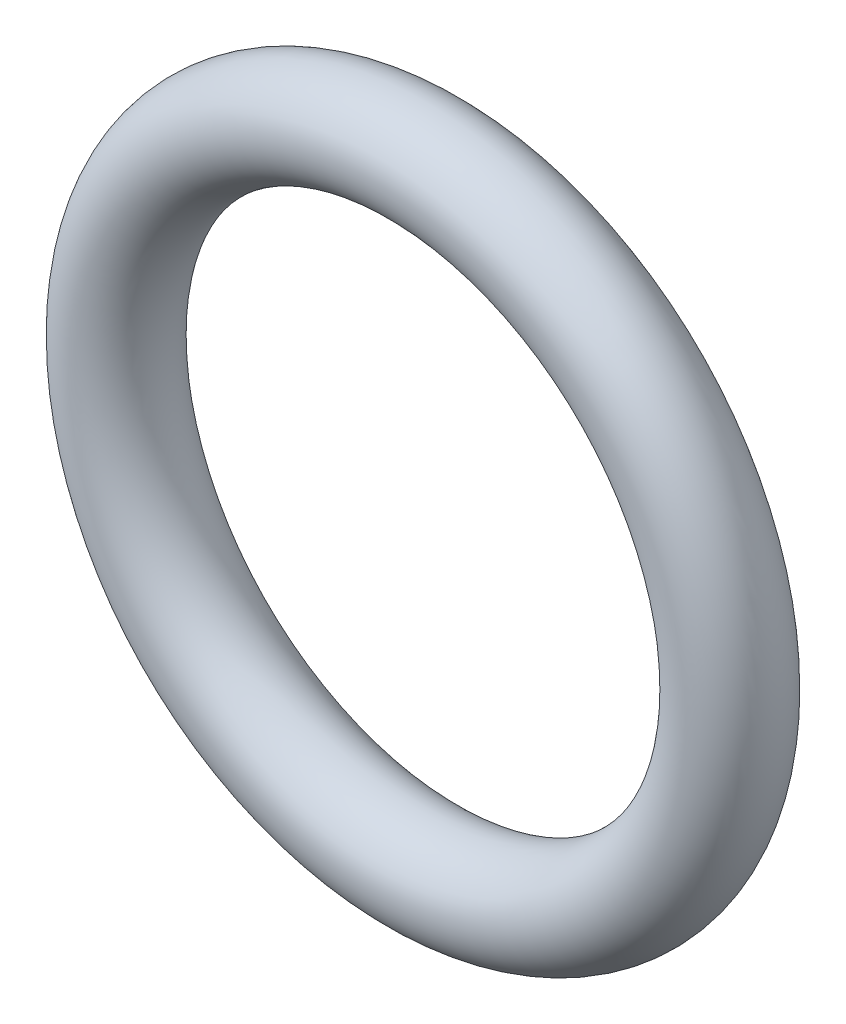
from build123d import *

# Parameters (mm, degrees)
SKETCH1_R = 0.889


with BuildPart() as part:
    # Sketch1 → Revolve1 (revolve)
    with BuildSketch(Plane(origin=(0, 0, 0), x_dir=(0, -1, 0), z_dir=(1, 0, 0))):
        with Locations((5.5118, 0)):
            Circle(SKETCH1_R)
    revolve(axis=Axis((0, 0, 0.889), (0, 0, -1)))


solid = part.part
